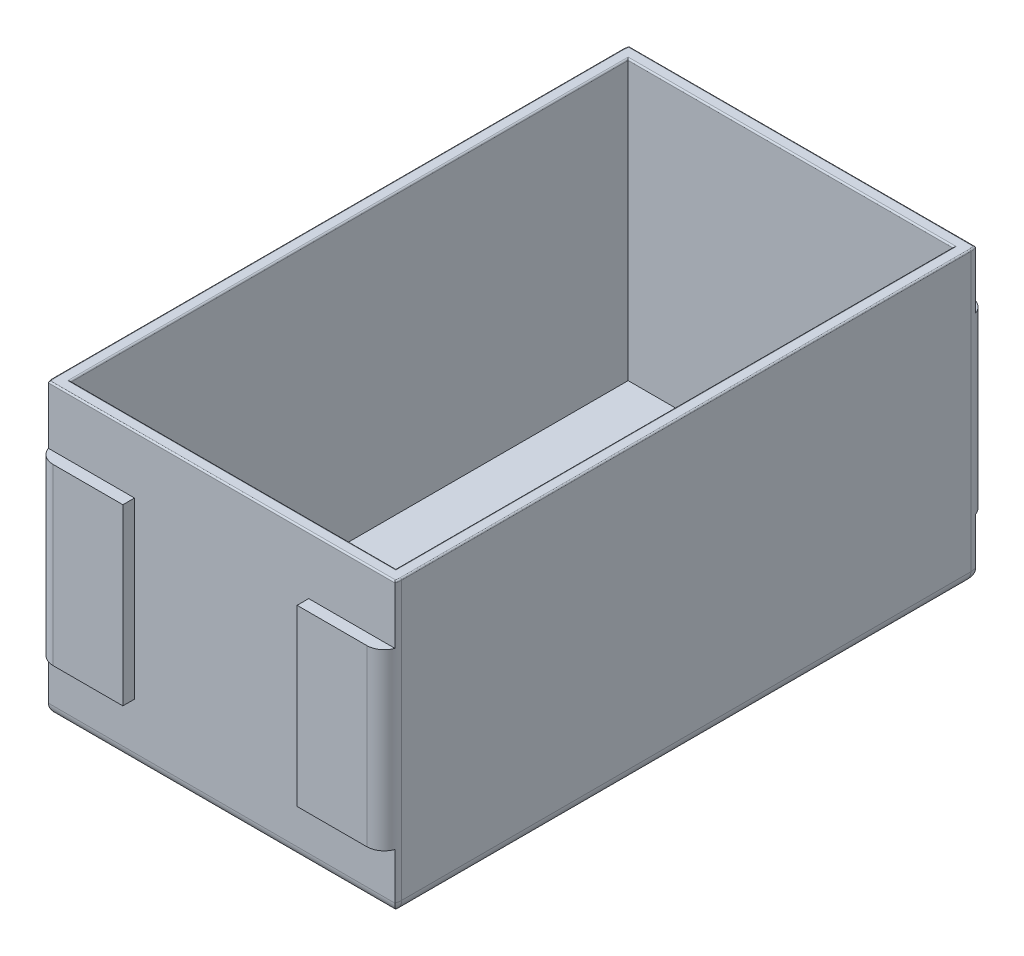
from build123d import *

# Parameters (mm, degrees)
SKETCH2_W            = 60
SKETCH2_H            = 100
BOSS_EXTRUDE1_DEPTH  = 50
SKETCH3_W            = 56
SKETCH3_H            = 96
CUT_EXTRUDE1_DEPTH   = 48
SKETCH4_W            = 15
SKETCH4_H            = 30
BOSS_EXTRUDE2_DEPTH  = 2
FILLET1_R            = 3
FILLET1_OF_MIRROR1_R = 3
FILLET2_R            = 2
FILLET3_R            = 0.25


with BuildPart() as part:
    # Sketch2 → Boss-Extrude1 (new body)
    with BuildSketch(Plane(origin=(0, 0, 0), x_dir=(1, 0, 0), z_dir=(0, 1, 0))):
        Rectangle(SKETCH2_W, SKETCH2_H)
    extrude(amount=BOSS_EXTRUDE1_DEPTH)

    # Sketch3 → Cut-Extrude1 (cut)
    with BuildSketch(Plane(origin=(0, 50, 0), x_dir=(1, 0, 0), z_dir=(0, 1, 0))):
        Rectangle(SKETCH3_W, SKETCH3_H)
    extrude(amount=-CUT_EXTRUDE1_DEPTH, mode=Mode.SUBTRACT)

    # Sketch4 → Boss-Extrude2 (add)
    with BuildSketch(Plane(origin=(0, 0, -50), x_dir=(-1, 0, 0), z_dir=(0, 0, -1))):
        with Locations((-22.5, 25)):
            Rectangle(SKETCH4_W, SKETCH4_H)
        with Locations((22.5, 25)):
            Rectangle(SKETCH4_W, SKETCH4_H)
    boss_extrude2 = extrude(amount=BOSS_EXTRUDE2_DEPTH)

    # Fillet1
    fillet1_edges = [part.edges().sort_by_distance(p)[0] for p in [
        (30, 25, -52),
        (-30, 25, -52),
    ]]
    fillet(fillet1_edges, radius=FILLET1_R)

    # Mirror1: Boss-Extrude2 across plane
    add(boss_extrude2.mirror(Plane.XY))

    # Fillet1 of Mirror1
    fillet1_of_mirror1_edges = [part.edges().sort_by_distance(p)[0] for p in [
        (30, 25, 52),
        (-30, 25, 52),
    ]]
    fillet(fillet1_of_mirror1_edges, radius=FILLET1_OF_MIRROR1_R)

    # Fillet2
    # the kernel refuses this fillet: 2 mm, written as the material it takes off along each edge
    with BuildSketch(Plane(origin=(34.828427125, 0, -50), x_dir=(0, 0, 1), z_dir=(-1, 0, 0)), Plane(origin=(-34.828427125, 0, 50), x_dir=(0, 0, -1), z_dir=(1, 0, 0))) as fillet2_piece_1:
        with BuildLine():
            CenterArc((FILLET2_R, FILLET2_R), FILLET2_R, 180, 90)
            Line((0, FILLET2_R), (0, 0))
            Line((0, 0), (FILLET2_R, 0))
        make_face()
    extrude(amount=69.656854249, mode=Mode.SUBTRACT)
    with BuildSketch(Plane(origin=(-30, 0, -49), x_dir=(0, 1, 0), z_dir=(0, 0, 1))) as fillet2_piece_2:
        with BuildLine():
            CenterArc((FILLET2_R, -FILLET2_R), FILLET2_R, 90, 90)
            Line((0, -FILLET2_R), (0, 0))
            Line((0, 0), (FILLET2_R, 0))
        make_face()
    extrude(amount=98, mode=Mode.SUBTRACT)
    with BuildSketch(Plane(origin=(30, 0, 49), x_dir=(-1, 0, 0), z_dir=(0, 0, -1))) as fillet2_piece_3:
        with BuildLine():
            CenterArc((FILLET2_R, FILLET2_R), FILLET2_R, 180, 90)
            Line((0, FILLET2_R), (0, 0))
            Line((0, 0), (FILLET2_R, 0))
        make_face()
    extrude(amount=98, mode=Mode.SUBTRACT)
    with BuildSketch(Plane(origin=(27, 0, 49), x_dir=(1, 0, 0), z_dir=(0, 0, -1))) as fillet2_piece_4:
        with BuildLine():
            CenterArc((3 - FILLET2_R, -FILLET2_R), FILLET2_R, 0, 90)
            Line((3, -FILLET2_R), (3, 0))
            Line((3, 0), (3 - FILLET2_R, 0))
        make_face()
    revolve(axis=Axis((27, 0, 49), (0, -1, 0)), revolution_arc=114.9659815, mode=Mode.SUBTRACT)
    with BuildSketch(Plane(origin=(27, 0, -49), x_dir=(1, 0, 0), z_dir=(0, 0, 1))) as fillet2_piece_5:
        with BuildLine():
            CenterArc((3 - FILLET2_R, FILLET2_R), FILLET2_R, 270, 90)
            Line((3, FILLET2_R), (3, 0))
            Line((3, 0), (3 - FILLET2_R, 0))
        make_face()
    revolve(axis=Axis((27, 0, -49), (0, 1, 0)), revolution_arc=114.9659815, mode=Mode.SUBTRACT)
    with BuildSketch(Plane(origin=(-27, 0, -49), x_dir=(-1, 0, 0), z_dir=(0, 0, 1))) as fillet2_piece_6:
        with BuildLine():
            CenterArc((3 - FILLET2_R, -FILLET2_R), FILLET2_R, 0, 90)
            Line((3 - FILLET2_R, 0), (3, 0))
            Line((3, 0), (3, -FILLET2_R))
        make_face()
    revolve(axis=Axis((-27, 0, -49), (0, -1, 0)), revolution_arc=114.9659815, mode=Mode.SUBTRACT)
    with BuildSketch(Plane(origin=(-27, 0, 49), x_dir=(-1, 0, 0), z_dir=(0, 0, -1))) as fillet2_piece_7:
        with BuildLine():
            CenterArc((3 - FILLET2_R, FILLET2_R), FILLET2_R, 270, 90)
            Line((3 - FILLET2_R, 0), (3, 0))
            Line((3, 0), (3, FILLET2_R))
        make_face()
    revolve(axis=Axis((-27, 0, 49), (0, 1, 0)), revolution_arc=114.9659815, mode=Mode.SUBTRACT)

    # Fillet3
    fillet3_edges = [part.edges().sort_by_distance(p)[0] for p in [
        (0, 50, 50),
        (-29.956795679, 50, 49.507305936),
        (29.956795679, 50, 49.507305936),
        (28, 50, 0),
        (0, 50, -48),
        (-28, 50, 0),
        (0, 50, 48),
        (0, 50, -50),
        (-30, 50, 0),
        (-29.956795679, 50, -49.507305936),
        (29.956795679, 50, -49.507305936),
        (30, 50, 0),
    ]]
    fillet(fillet3_edges, radius=FILLET3_R)


solid = part.part
